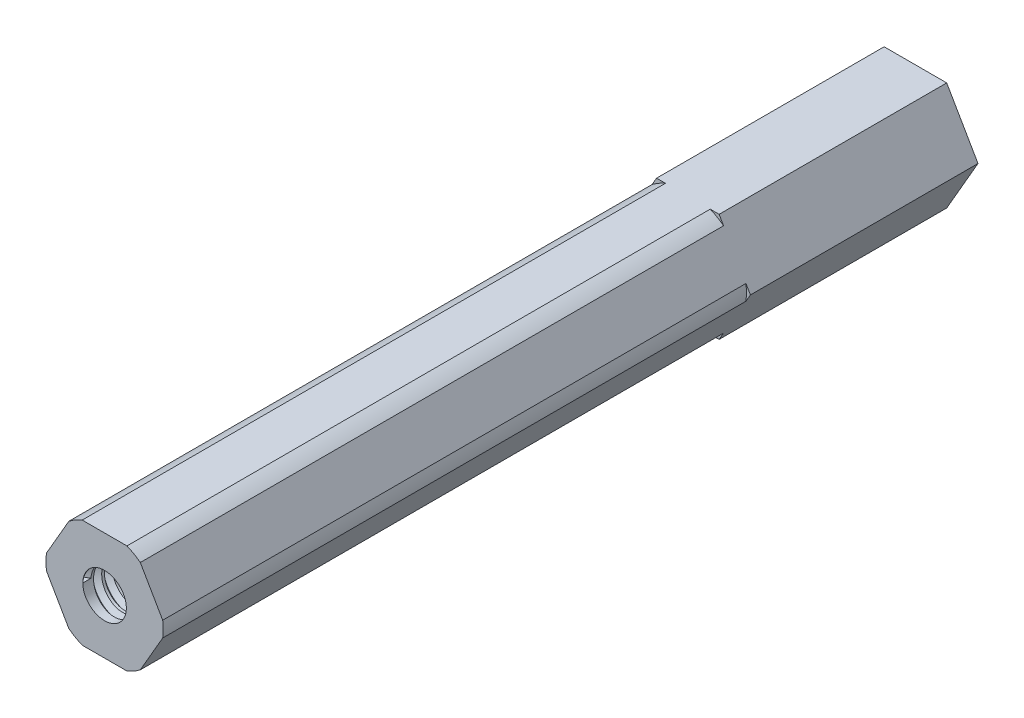
from build123d import *
from build123d.topology import SkipClean

# Parameters (mm, degrees)
EXTRUSI_N_HEX_PROFILE_DEPTH = 47.5107
TAP_START                   = 47.5107
CROQUIS3_R                  = 2.5527
TAP_HOLE_1_DEPTH            = 19.05
TAP_START_2                 = -28.4607
CROQUIS3_3_R                = 2.5527
TAP_HOLE_2_DEPTH            = 19.05
THUNDERHEX_DEPTH            = 49.490746002
THUNDERHEX_DEPTH_BACK       = 20.8407
CROQUIS7_OUTSIDE_W          = 36.06
CROQUIS7_OUTSIDE_H          = 34.096
CROQUIS7_OUTSIDE_R          = 6.8707
ROSCA1_PITCH                = 1.27
ROSCA2_PITCH                = 1.27


with BuildPart() as part:
    # Croquis2 → Extrusión Hex Profile (new, symmetric)
    with BuildSketch(Plane.XY):
        Polygon((3.666174209, -6.35), (7.332348419, 0), (3.666174209, 6.35), (-3.666174209, 6.35), (-7.332348419, 0), (-3.666174209, -6.35), align=None)
    extrude(amount=EXTRUSI_N_HEX_PROFILE_DEPTH, both=True)

    # Croquis3 → Tap Hole 1 (cut)
    with BuildSketch(Plane.XY.offset(TAP_START)):
        Circle(CROQUIS3_R)
    extrude(amount=-TAP_HOLE_1_DEPTH, mode=Mode.SUBTRACT)

    # Croquis3<3> → Tap Hole 2 (cut)
    with BuildSketch(Plane.XY.offset(TAP_START_2)):
        Circle(CROQUIS3_3_R)
    extrude(amount=-TAP_HOLE_2_DEPTH, mode=Mode.SUBTRACT)

    # Croquis7 outside → ThunderHex (cut, two sides: drawn at the far end of the back side and taken through both)
    with BuildSketch(Plane.XY.offset(-THUNDERHEX_DEPTH_BACK)):
        Rectangle(CROQUIS7_OUTSIDE_W, CROQUIS7_OUTSIDE_H)
        Circle(CROQUIS7_OUTSIDE_R, mode=Mode.SUBTRACT)
    extrude(amount=THUNDERHEX_DEPTH + THUNDERHEX_DEPTH_BACK, mode=Mode.SUBTRACT)

    # Rosca1: the profile of Perfil de rosca2 profile screwed along a right-hand helix of 15 turns, 8 arcs to a turn; built about Z, then put on its axis
    with SkipClean():  # the faces are left unmerged after this step: merging them gives an invalid solid
        rosca1_z = Axis((0, 0, 0), (0, 0, 1))
        rosca1_corners = [(2.5524, 0, -0.000173205), (3.240107661, 0, 0.396874998), (3.240107661, 0, 0.555624998), (2.5524, 0, 0.952673202)]
        with BuildLine(mode=Mode.PRIVATE) as rosca1_profile:
            Line(rosca1_corners[0], rosca1_corners[1])
            Line(rosca1_corners[1], rosca1_corners[2])
            Line(rosca1_corners[2], rosca1_corners[3])
            Line(rosca1_corners[3], rosca1_corners[0])
        rosca1_cap = Face(rosca1_profile.wire())
        rosca1_turn_angles = [0, 22.5, 45, 67.5, 90, 112.5, 135, 157.5, 180, 202.5, 225, 247.5, 270, 292.5, 315, 337.5, 360]
        rosca1_turn_weights = [1, 0.9238795325112867, 1, 0.9238795325112867, 1, 0.9238795325112867, 1, 0.9238795325112867, 1, 0.9238795325112867, 1, 0.9238795325112867, 1, 0.9238795325112867, 1, 0.9238795325112867, 1]
        rosca1_turn_rails = [Edge.make_bspline([Vector(p[0], p[1], 0).rotate(rosca1_z, rosca1_turn_angles[k]) / rosca1_turn_weights[k] + Vector(0, 0, p[2] + ROSCA1_PITCH * rosca1_turn_angles[k] / 360) for k in range(17)], [0, 0, 0, 1, 1, 2, 2, 3, 3, 4, 4, 5, 5, 6, 6, 7, 7, 8, 8, 8], 2, rosca1_turn_weights) for p in rosca1_corners]
        rosca1_turn_sides = [Face.make_surface_from_curves(rosca1_turn_rails[p[0]], rosca1_turn_rails[p[1]]) for p in [(0, 1), (1, 2), (2, 3), (3, 0)]]
        rosca1 = Plane(origin=(0, 0, 47.5107), x_dir=(-1, 0, 0), z_dir=(0, 0, -1)) * Solid(Shell([*[p.moved(Location((0, 0, ROSCA1_PITCH * i))) for i in range(15) for p in rosca1_turn_sides], rosca1_cap, rosca1_cap.rotate(rosca1_z, 5400).moved(Location((0, 0, ROSCA1_PITCH * 5400 / 360)))]))
        add(rosca1, mode=Mode.SUBTRACT)

    # Rosca2: the profile of Perfil de rosca3 profile screwed along a right-hand helix of 15 turns, 8 arcs to a turn; built about Z, then put on its axis
    with SkipClean():  # the faces are left unmerged after this step: merging them gives an invalid solid
        rosca2_z = Axis((0, 0, 0), (0, 0, 1))
        rosca2_corners = [(2.5524, 0, -0.000173205), (3.240107661, 0, 0.396874998), (3.240107661, 0, 0.555624998), (2.5524, 0, 0.952673202)]
        with BuildLine(mode=Mode.PRIVATE) as rosca2_profile:
            Line(rosca2_corners[0], rosca2_corners[1])
            Line(rosca2_corners[1], rosca2_corners[2])
            Line(rosca2_corners[2], rosca2_corners[3])
            Line(rosca2_corners[3], rosca2_corners[0])
        rosca2_cap = Face(rosca2_profile.wire())
        rosca2_turn_angles = [0, 22.5, 45, 67.5, 90, 112.5, 135, 157.5, 180, 202.5, 225, 247.5, 270, 292.5, 315, 337.5, 360]
        rosca2_turn_weights = [1, 0.9238795325112867, 1, 0.9238795325112867, 1, 0.9238795325112867, 1, 0.9238795325112867, 1, 0.9238795325112867, 1, 0.9238795325112867, 1, 0.9238795325112867, 1, 0.9238795325112867, 1]
        rosca2_turn_rails = [Edge.make_bspline([Vector(p[0], p[1], 0).rotate(rosca2_z, rosca2_turn_angles[k]) / rosca2_turn_weights[k] + Vector(0, 0, p[2] + ROSCA2_PITCH * rosca2_turn_angles[k] / 360) for k in range(17)], [0, 0, 0, 1, 1, 2, 2, 3, 3, 4, 4, 5, 5, 6, 6, 7, 7, 8, 8, 8], 2, rosca2_turn_weights) for p in rosca2_corners]
        rosca2_turn_sides = [Face.make_surface_from_curves(rosca2_turn_rails[p[0]], rosca2_turn_rails[p[1]]) for p in [(0, 1), (1, 2), (2, 3), (3, 0)]]
        rosca2 = Plane(origin=(0, 0, -47.5107), x_dir=(1, 0, 0), z_dir=(0, 0, 1)) * Solid(Shell([*[p.moved(Location((0, 0, ROSCA2_PITCH * i))) for i in range(15) for p in rosca2_turn_sides], rosca2_cap, rosca2_cap.rotate(rosca2_z, 5400).moved(Location((0, 0, ROSCA2_PITCH * 5400 / 360)))]))
        add(rosca2, mode=Mode.SUBTRACT)


solid = part.part
